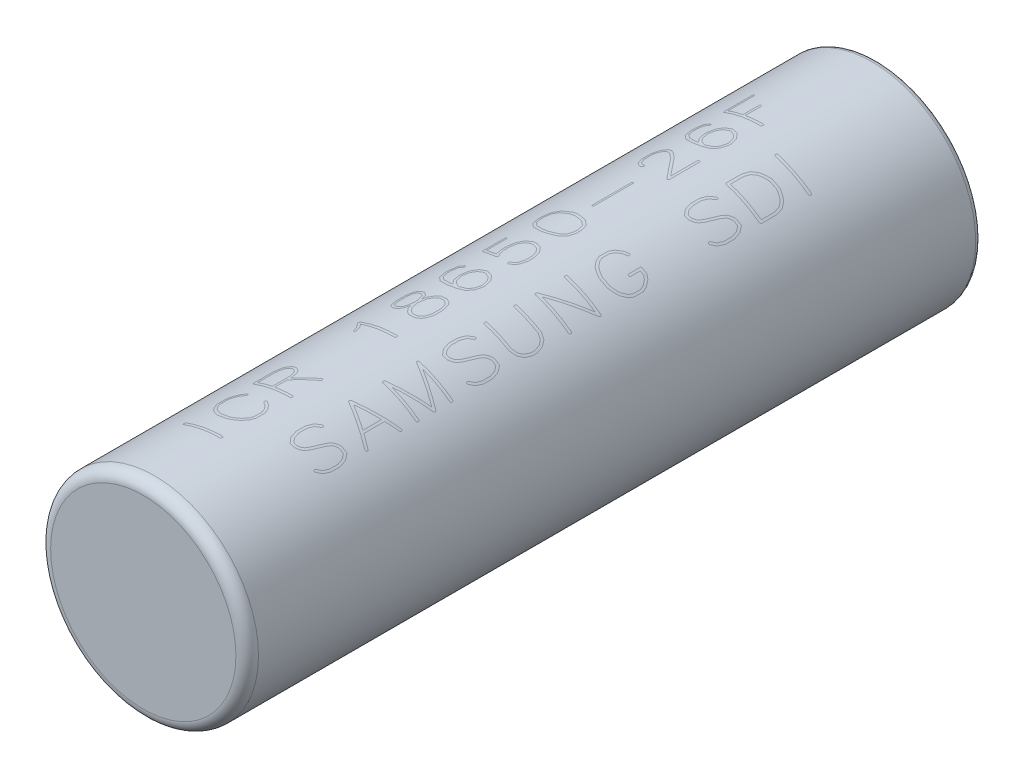
from build123d import *

# Parameters (mm, degrees)
CROQUIS1_R              = 9.2
SALIENTE_EXTRUIR1_DEPTH = 65
REDONDEO1_R             = 1
REDONDEO2_R             = 0.5


with BuildPart() as part:
    # Croquis1 → Saliente-Extruir1 (new body)
    with BuildSketch(Plane.XY):
        Circle(CROQUIS1_R)
    extrude(amount=SALIENTE_EXTRUIR1_DEPTH)

    # Redondeo1
    redondeo1_edges = [part.edges().sort_by_distance(p)[0] for p in [
        (-9.2, 0, 65),
    ]]
    fillet(redondeo1_edges, radius=REDONDEO1_R)

    # Redondeo2
    redondeo2_edges = [part.edges().sort_by_distance(p)[0] for p in [
        (-9.2, 0, 0),
    ]]
    fillet(redondeo2_edges, radius=REDONDEO2_R)


solid = part.part
